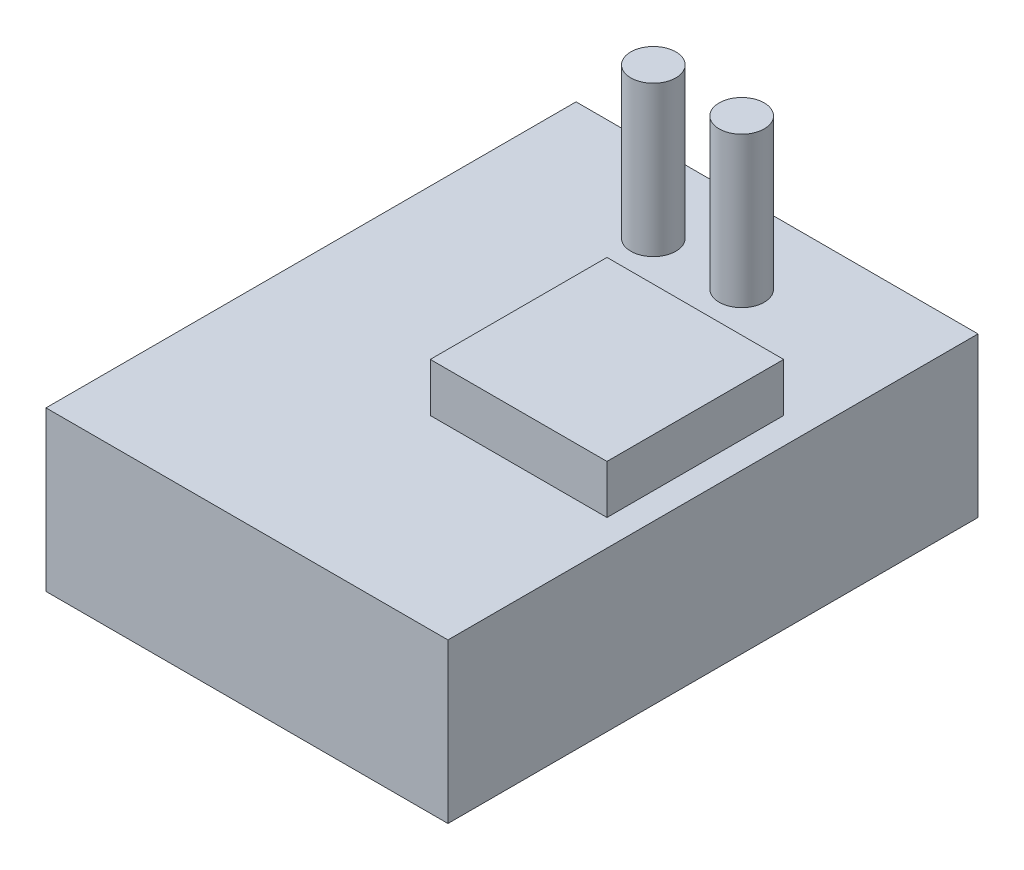
from build123d import *

# Parameters (mm, degrees)
ESBO_O1_W                = 91
ESBO_O1_H                = 120
RESSALTO_EXTRUS_O1_DEPTH = 36
ESBO_O2_W                = 40
ESBO_O2_H                = 40
RESSALTO_EXTRUS_O2_DEPTH = 11
ESBO_O3_R                = 5.1
RESSALTO_EXTRUS_O3_DEPTH = 34


with BuildPart() as part:
    # Esboço1 → Ressalto-extrusão1 (new body)
    with BuildSketch(Plane(origin=(0, 0, 0), x_dir=(1, 0, 0), z_dir=(0, 1, 0))):
        Rectangle(ESBO_O1_W, ESBO_O1_H)
    extrude(amount=RESSALTO_EXTRUS_O1_DEPTH)

    # Esboço2 → Ressalto-extrusão2 (add)
    with BuildSketch(Plane(origin=(0, 36, 0), x_dir=(1, 0, 0), z_dir=(0, 1, 0))):
        with Locations((19.5, 2)):
            Rectangle(ESBO_O2_W, ESBO_O2_H)
    extrude(amount=RESSALTO_EXTRUS_O2_DEPTH)

    # Esboço3 → Ressalto-extrusão3 (add)
    with BuildSketch(Plane(origin=(0, 36, 0), x_dir=(1, 0, 0), z_dir=(0, 1, 0))):
        with Locations((-10, 42)):
            Circle(ESBO_O3_R)
        with Locations((10, 42)):
            Circle(ESBO_O3_R)
    extrude(amount=RESSALTO_EXTRUS_O3_DEPTH)


solid = part.part
